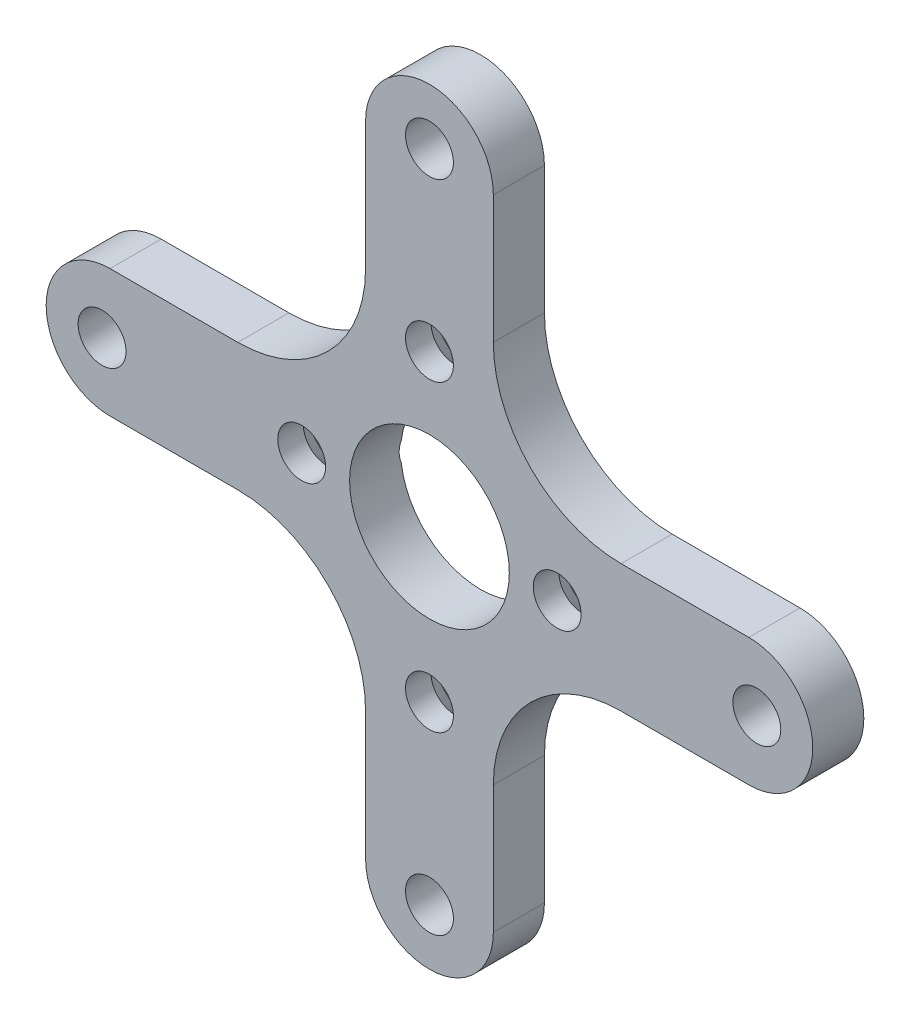
from build123d import *

# Parameters (mm, degrees)
SKETCH_1_R      = 5
SKETCH_1_R_2    = 1.5
EXTRUDE_1_DEPTH = 3.2
CHAMFER_1_SIZE  = 1.6


with BuildPart() as part:
    # Эскиз1 → Бобышка-Вытянуть1 (new body)
    with BuildSketch(Plane.XY):
        with BuildLine():
            Line((-4, 20), (-4, 12))
            ThreePointArc((-4, 12), (-6.343145751, 6.343145751), (-12, 4))
            Line((-12, 4), (-20, 4))
            ThreePointArc((-20, 4), (-24, 0), (-20, -4))
            Line((-20, -4), (-12, -4))
            ThreePointArc((-12, -4), (-6.343145751, -6.343145751), (-4, -12))
            Line((-4, -12), (-4, -20))
            ThreePointArc((-4, -20), (0, -24), (4, -20))
            Line((4, -20), (4, -12))
            ThreePointArc((4, -12), (6.343145751, -6.343145751), (12, -4))
            Line((12, -4), (20, -4))
            ThreePointArc((20, -4), (24, 0), (20, 4))
            Line((20, 4), (12, 4))
            ThreePointArc((12, 4), (6.343145751, 6.343145751), (4, 12))
            Line((4, 12), (4, 20))
            ThreePointArc((4, 20), (0, 24), (-4, 20))
        make_face()
        Circle(SKETCH_1_R, mode=Mode.SUBTRACT)
        with Locations((0, 9.5)):
            Circle(SKETCH_1_R_2, mode=Mode.SUBTRACT)
        with Locations((0, -9.5)):
            Circle(SKETCH_1_R_2, mode=Mode.SUBTRACT)
        with Locations((-8, 0)):
            Circle(SKETCH_1_R_2, mode=Mode.SUBTRACT)
        with Locations((8, 0)):
            Circle(SKETCH_1_R_2, mode=Mode.SUBTRACT)
        with Locations((0, 20.5)):
            Circle(SKETCH_1_R_2, mode=Mode.SUBTRACT)
        with Locations((20.5, 0)):
            Circle(SKETCH_1_R_2, mode=Mode.SUBTRACT)
        with Locations((-20.5, 0)):
            Circle(SKETCH_1_R_2, mode=Mode.SUBTRACT)
        with Locations((0, -20.5)):
            Circle(SKETCH_1_R_2, mode=Mode.SUBTRACT)
    extrude(amount=EXTRUDE_1_DEPTH)

    # Фаска1
    # the kernel refuses this chamfer: 1.6 mm, written as the material it takes off along each edge
    with BuildSketch(Plane(origin=(0, 9.5, 0), x_dir=(1, 0, 0), z_dir=(0, -1, 0))) as chamfer_1_piece_1:
        Polygon((1.5, CHAMFER_1_SIZE), (1.5 + CHAMFER_1_SIZE, 0), (1.5, 0), align=None)
    revolve(axis=Axis((0, 9.5, 0), (0, 0, 1)), mode=Mode.SUBTRACT)
    with BuildSketch(Plane(origin=(0, -9.5, 0), x_dir=(1, 0, 0), z_dir=(0, -1, 0))) as chamfer_1_piece_2:
        Polygon((1.5, CHAMFER_1_SIZE), (1.5 + CHAMFER_1_SIZE, 0), (1.5, 0), align=None)
    revolve(axis=Axis((0, -9.5, 0), (0, 0, 1)), mode=Mode.SUBTRACT)
    with BuildSketch(Plane(origin=(-8, 0, 0), x_dir=(1, 0, 0), z_dir=(0, -1, 0))) as chamfer_1_piece_3:
        Polygon((1.5, CHAMFER_1_SIZE), (1.5 + CHAMFER_1_SIZE, 0), (1.5, 0), align=None)
    revolve(axis=Axis((-8, 0, 0), (0, 0, 1)), mode=Mode.SUBTRACT)
    with BuildSketch(Plane(origin=(8, 0, 0), x_dir=(1, 0, 0), z_dir=(0, -1, 0))) as chamfer_1_piece_4:
        Polygon((1.5, CHAMFER_1_SIZE), (1.5 + CHAMFER_1_SIZE, 0), (1.5, 0), align=None)
    revolve(axis=Axis((8, 0, 0), (0, 0, 1)), mode=Mode.SUBTRACT)


solid = part.part
